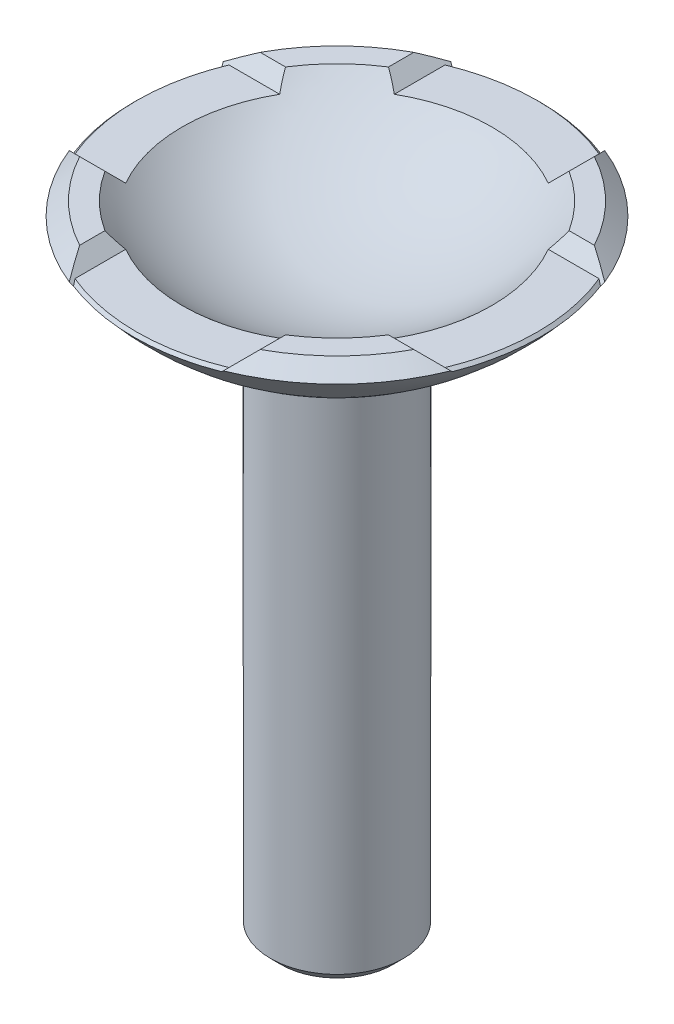
from build123d import *

# Parameters (mm, degrees)
CUT_EXTRUDE1_DEPTH      = 134.095432677
CIRPATTERN1_COUNT       = 2
CIRPATTERN1_ANGLE       = 90
CUT_EXTRUDE2_DEPTH      = 134.095432677
CUT_EXTRUDE2_DEPTH_BACK = 134.095432677
SKETCH4_W               = 71.692857504
SKETCH4_H               = 7.538034042
CHAMFER1_SIZE           = 1
CHAMFER2_SIZE           = 2


with BuildPart() as part:
    # Sketch2 → Revolve1 (revolve)
    with BuildSketch(Plane.XY, mode=Mode.PRIVATE) as revolve1_sk:
        with BuildLine():
            Line((0, 0), (-12.5, 0))
            Line((-12.5, 0), (-12.5, 100))
            ThreePointArc((-12.5, 100), (-26.960226668, 106.303549529), (-38.737016869, 116.798315107))
            Line((-38.737016869, 116.798315107), (-33.374125702, 121.298315107))
            ThreePointArc((-33.374125702, 121.298315107), (-18.481057884, 109.586391973), (0, 105.412291828))
            Line((0, 105.412291828), (0, 0))
        make_face()
    revolve(revolve1_sk.sketch.rotate(Axis((0, 0, 0), (0, 1, 0)), 270), axis=Axis((0, 0, 0), (0, 1, 0)))

    # Sketch3 → Cut-Extrude1 (cut, symmetric)
    with BuildSketch(Plane(origin=(0, 0, 0), x_dir=(0, 0, -1), z_dir=(1, 0, 0))):
        Polygon((-19, 121.298315107), (19, 121.298315107), (14.5, 116.798315107), (-14.5, 116.798315107), align=None)
    cut_extrude1 = extrude(amount=CUT_EXTRUDE1_DEPTH, both=True, mode=Mode.SUBTRACT)

    # CirPattern1: Cut-Extrude1 ×2 about axis
    cirpattern1_axis = Axis((0, 0, 0), (0, 1, 0))
    for i in range(1, CIRPATTERN1_COUNT):
        add(cut_extrude1.rotate(cirpattern1_axis, i * CIRPATTERN1_ANGLE / (CIRPATTERN1_COUNT - 1)), mode=Mode.SUBTRACT)

    # Sketch4 → Cut-Extrude2 (cut, two sides: drawn at the far end of the back side and taken through both)
    with BuildSketch(Plane(origin=(0, 0, 0), x_dir=(0, 0, -1), z_dir=(1, 0, 0)).offset(-CUT_EXTRUDE2_DEPTH_BACK)):
        with Locations((0, 123.067332128)):
            Rectangle(SKETCH4_W, SKETCH4_H)
    extrude(amount=CUT_EXTRUDE2_DEPTH + CUT_EXTRUDE2_DEPTH_BACK, mode=Mode.SUBTRACT)

    # Chamfer1
    # the kernel refuses this chamfer: 1, 0.710722016 mm, written as the material it takes off along each edge
    with BuildSketch(Plane(origin=(0, 116.798315107, 0), x_dir=(-0.900422371239431, 0, -0.43501672769166055), z_dir=(0.43501672769166055, 0, -0.900422371239431))) as chamfer1_piece_1_section:
        with BuildLine():
            Line((38.28405682, -0.547039951), (38.737016869 - CHAMFER1_SIZE, 0))
            Line((38.737016869 - CHAMFER1_SIZE, 0), (38.737016869, 0))
            ThreePointArc((38.737016869, 0), (38.510313841, -0.275766581), (38.28405682, -0.547039951))
        make_face()
    chamfer1_piece_1 = revolve(axis=Axis((0, 116.798315107, 0), (0, 1, 0)), revolution_arc=51.572716584, mode=Mode.PRIVATE)
    chamfer1_piece_1 = split(chamfer1_piece_1, bisect_by=Plane(origin=(0, 109.548315107, -7.25), z_dir=(0, 0.7071067811865445, 0.7071067811865507)), keep=Keep.TOP, mode=Mode.PRIVATE)
    chamfer1_piece_1 = split(chamfer1_piece_1, bisect_by=Plane(origin=(0, 109.548315107, 7.25), z_dir=(0, 0.7071067811865445, -0.7071067811865507)), keep=Keep.TOP, mode=Mode.PRIVATE)
    add(chamfer1_piece_1, mode=Mode.SUBTRACT)
    with BuildSketch(Plane(origin=(0, 116.798315107, 0), x_dir=(0.9004223712394364, 0, 0.4350167276916494), z_dir=(-0.4350167276916494, 0, 0.9004223712394364))) as chamfer1_piece_2_section:
        with BuildLine():
            Line((38.28405682, -0.547039951), (38.737016869 - CHAMFER1_SIZE, 0))
            Line((38.737016869 - CHAMFER1_SIZE, 0), (38.737016869, 0))
            ThreePointArc((38.737016869, 0), (38.510313841, -0.275766581), (38.28405682, -0.547039951))
        make_face()
    chamfer1_piece_2 = revolve(axis=Axis((0, 116.798315107, 0), (0, 1, 0)), revolution_arc=51.572716584, mode=Mode.PRIVATE)
    chamfer1_piece_2 = split(chamfer1_piece_2, bisect_by=Plane(origin=(0, 109.548315107, 7.25), z_dir=(0, 0.7071067811865445, -0.7071067811865507)), keep=Keep.TOP, mode=Mode.PRIVATE)
    chamfer1_piece_2 = split(chamfer1_piece_2, bisect_by=Plane(origin=(0, 109.548315107, -7.25), z_dir=(0, 0.7071067811865445, 0.7071067811865507)), keep=Keep.TOP, mode=Mode.PRIVATE)
    add(chamfer1_piece_2, mode=Mode.SUBTRACT)
    with BuildSketch(Plane(origin=(0, 116.798315107, 0), x_dir=(-0.43501672769166544, 0, 0.9004223712394286), z_dir=(-0.9004223712394286, 0, -0.43501672769166544))) as chamfer1_piece_3_section:
        with BuildLine():
            Line((38.28405682, -0.547039951), (38.737016869 - CHAMFER1_SIZE, 0))
            Line((38.737016869 - CHAMFER1_SIZE, 0), (38.737016869, 0))
            ThreePointArc((38.737016869, 0), (38.510313841, -0.275766581), (38.28405682, -0.547039951))
        make_face()
    chamfer1_piece_3 = revolve(axis=Axis((0, 116.798315107, 0), (0, 1, 0)), revolution_arc=51.572716584, mode=Mode.PRIVATE)
    chamfer1_piece_3 = split(chamfer1_piece_3, bisect_by=Plane(origin=(-7.25, 109.548315107, 0), z_dir=(0.7071067811865507, 0.7071067811865445, -2.5121479338940513e-15)), keep=Keep.TOP, mode=Mode.PRIVATE)
    chamfer1_piece_3 = split(chamfer1_piece_3, bisect_by=Plane(origin=(7.25, 109.548315107, 0), z_dir=(-0.7071067811865507, 0.7071067811865445, 2.5121479338940513e-15)), keep=Keep.TOP, mode=Mode.PRIVATE)
    add(chamfer1_piece_3, mode=Mode.SUBTRACT)
    with BuildSketch(Plane(origin=(0, 116.798315107, 0), x_dir=(0.4350124309167343, 0, -0.9004244471069814), z_dir=(0.9004244471069814, 0, 0.4350124309167343))) as chamfer1_piece_4_section:
        with BuildLine():
            Line((38.28405682, -0.547039951), (38.737016869 - CHAMFER1_SIZE, 0))
            Line((38.737016869 - CHAMFER1_SIZE, 0), (38.737016869, 0))
            ThreePointArc((38.737016869, 0), (38.510313841, -0.275766581), (38.28405682, -0.547039951))
        make_face()
    chamfer1_piece_4 = revolve(axis=Axis((0, 116.798315107, 0), (0, 1, 0)), revolution_arc=25.786084879, mode=Mode.PRIVATE)
    chamfer1_piece_4 = split(chamfer1_piece_4, bisect_by=Plane(origin=(7.25, 109.548315107, 0), z_dir=(-0.7071067811865507, 0.7071067811865445, 2.5121479338940513e-15)), keep=Keep.TOP, mode=Mode.PRIVATE)
    add(chamfer1_piece_4, mode=Mode.SUBTRACT)
    with BuildSketch(Plane(origin=(0, 116.798315107, 0), x_dir=(0, 0, -1), z_dir=(1, 0, 0))) as chamfer1_piece_5_section:
        with BuildLine():
            Line((38.28405682, -0.547039951), (38.737016869 - CHAMFER1_SIZE, 0))
            Line((38.737016869 - CHAMFER1_SIZE, 0), (38.737016869, 0))
            ThreePointArc((38.737016869, 0), (38.510313841, -0.275766581), (38.28405682, -0.547039951))
        make_face()
    chamfer1_piece_5 = revolve(axis=Axis((0, 116.798315107, 0), (0, 1, 0)), revolution_arc=25.786084879, mode=Mode.PRIVATE)
    chamfer1_piece_5 = split(chamfer1_piece_5, bisect_by=Plane(origin=(-7.25, 109.548315107, 0), z_dir=(0.7071067811865507, 0.7071067811865445, -2.5121479338940513e-15)), keep=Keep.TOP, mode=Mode.PRIVATE)
    add(chamfer1_piece_5, mode=Mode.SUBTRACT)

    # Chamfer2
    chamfer2_edges = [part.edges().sort_by_distance(p)[0] for p in [
        (0, 0, 12.5),
    ]]
    chamfer(chamfer2_edges, length=CHAMFER2_SIZE)


solid = part.part
